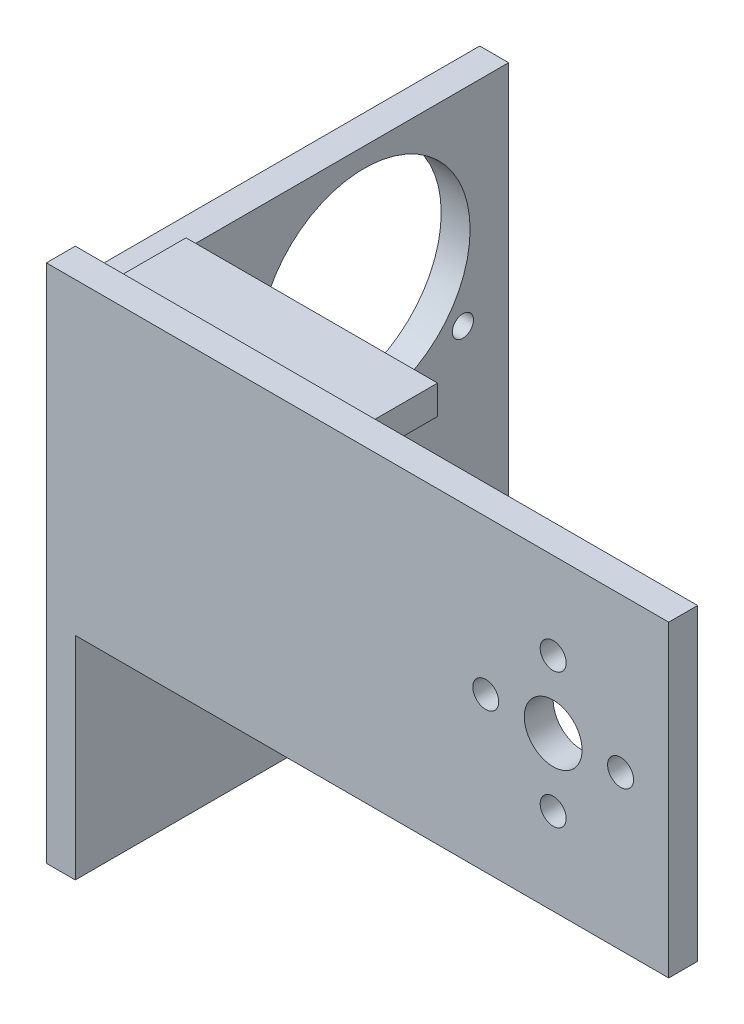
from build123d import *

# Parameters (mm, degrees)
S_BOX1_W      = 64.625
S_BOX1_H      = 32
BOSS_1_DEPTH  = 3
S_BOX2_W      = 3
S_BOX2_H      = 51
BOSS_2_DEPTH  = 45
S_BOX3_W      = 26.125
S_BOX3_H      = 3
BOSS_3_DEPTH  = 11.5
S_BOX4_W      = 26.125
S_BOX4_H      = 3
BOSS_4_DEPTH  = 11.5
S_HOLE5_R     = 3
HOLE_5_DEPTH  = 3.2
S_HOLE6_R     = 1.35
HOLE_6_DEPTH  = 3.2
S_HOLE7_R     = 1.35
HOLE_7_DEPTH  = 3.2
S_HOLE8_R     = 1.35
HOLE_8_DEPTH  = 3.2
S_HOLE9_R     = 1.35
HOLE_9_DEPTH  = 3.2
S_HOLE10_R    = 11
HOLE_10_DEPTH = 3.2
S_HOLE11_R    = 1.1
HOLE_11_DEPTH = 3.2
S_HOLE12_R    = 1.1
HOLE_12_DEPTH = 3.2
S_HOLE13_R    = 1.1
HOLE_13_DEPTH = 3.2
S_HOLE14_R    = 1.1
HOLE_14_DEPTH = 3.2


with BuildPart() as part:
    # S_box1 → Boss_1 (new body)
    with BuildSketch(Plane.XY.offset(27)):
        with Locations((-20.3125, 0)):
            Rectangle(S_BOX1_W, S_BOX1_H)
    extrude(amount=BOSS_1_DEPTH)

    # S_box2 → Boss_2 (add)
    with BuildSketch(Plane.XY.offset(-15)):
        with Locations((-51.125, -12.5)):
            Rectangle(S_BOX2_W, S_BOX2_H)
    extrude(amount=BOSS_2_DEPTH)

    # S_box3 → Boss_3 (add)
    with BuildSketch(Plane.XY.offset(18)):
        with Locations((-37.0625, 12)):
            Rectangle(S_BOX3_W, S_BOX3_H)
    extrude(amount=BOSS_3_DEPTH)

    # S_box4 → Boss_4 (add)
    with BuildSketch(Plane.XY.offset(18)):
        with Locations((-37.0625, -14.5)):
            Rectangle(S_BOX4_W, S_BOX4_H)
    extrude(amount=BOSS_4_DEPTH)

    # S_hole5 → Hole_5 (cut)
    with BuildSketch(Plane.XY.offset(26.9)):
        Circle(S_HOLE5_R)
    extrude(amount=HOLE_5_DEPTH, mode=Mode.SUBTRACT)

    # S_hole6 → Hole_6 (cut)
    with BuildSketch(Plane.XY.offset(26.9)):
        with Locations((7, 0)):
            Circle(S_HOLE6_R)
    extrude(amount=HOLE_6_DEPTH, mode=Mode.SUBTRACT)

    # S_hole7 → Hole_7 (cut)
    with BuildSketch(Plane.XY.offset(26.9)):
        with Locations((0, 7)):
            Circle(S_HOLE7_R)
    extrude(amount=HOLE_7_DEPTH, mode=Mode.SUBTRACT)

    # S_hole8 → Hole_8 (cut)
    with BuildSketch(Plane.XY.offset(26.9)):
        with Locations((-7, 0)):
            Circle(S_HOLE8_R)
    extrude(amount=HOLE_8_DEPTH, mode=Mode.SUBTRACT)

    # S_hole9 → Hole_9 (cut)
    with BuildSketch(Plane.XY.offset(26.9)):
        with Locations((0, -7)):
            Circle(S_HOLE9_R)
    extrude(amount=HOLE_9_DEPTH, mode=Mode.SUBTRACT)

    # S_hole10 → Hole_10 (cut)
    with BuildSketch(Plane(origin=(-52.725, 0, 0), x_dir=(0, 0, -1), z_dir=(1, 0, 0))):
        Circle(S_HOLE10_R)
    extrude(amount=HOLE_10_DEPTH, mode=Mode.SUBTRACT)

    # S_hole11 → Hole_11 (cut)
    with BuildSketch(Plane(origin=(-52.725, 0, 0), x_dir=(0, 0, -1), z_dir=(1, 0, 0))):
        with Locations((10.25, -8.3)):
            Circle(S_HOLE11_R)
    extrude(amount=HOLE_11_DEPTH, mode=Mode.SUBTRACT)

    # S_hole12 → Hole_12 (cut)
    with BuildSketch(Plane(origin=(-52.725, 0, 0), x_dir=(0, 0, -1), z_dir=(1, 0, 0))):
        with Locations((-10.25, -8.3)):
            Circle(S_HOLE12_R)
    extrude(amount=HOLE_12_DEPTH, mode=Mode.SUBTRACT)

    # S_hole13 → Hole_13 (cut)
    with BuildSketch(Plane(origin=(-52.725, 0, 0), x_dir=(0, 0, -1), z_dir=(1, 0, 0))):
        with Locations((10.25, -32.75)):
            Circle(S_HOLE13_R)
    extrude(amount=HOLE_13_DEPTH, mode=Mode.SUBTRACT)

    # S_hole14 → Hole_14 (cut)
    with BuildSketch(Plane(origin=(-52.725, 0, 0), x_dir=(0, 0, -1), z_dir=(1, 0, 0))):
        with Locations((-10.25, -32.75)):
            Circle(S_HOLE14_R)
    extrude(amount=HOLE_14_DEPTH, mode=Mode.SUBTRACT)


solid = part.part
